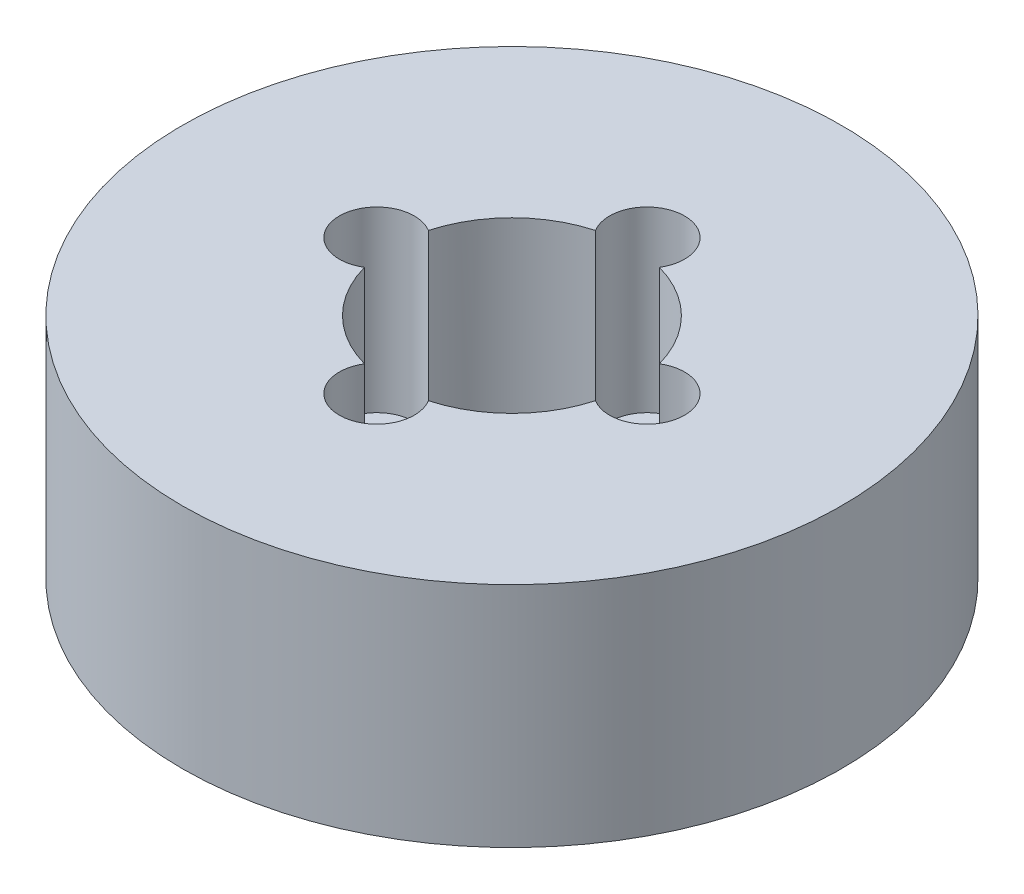
from build123d import *

# Parameters (mm, degrees)
SKETCH1_R           = 27.5
BOSS_EXTRUDE1_DEPTH = 19
SKETCH2_R           = 10
CUT_EXTRUDE1_DEPTH  = 44.283946216
SKETCH3_R           = 3.129604359
CUT_EXTRUDE2_DEPTH  = 14.865977008
CIRPATTERN1_COUNT   = 4


with BuildPart() as part:
    # Sketch1 → Boss-Extrude1 (new body)
    with BuildSketch(Plane(origin=(0, 0, 0), x_dir=(1, 0, 0), z_dir=(0, 1, 0))):
        Circle(SKETCH1_R)
    extrude(amount=BOSS_EXTRUDE1_DEPTH)

    # Sketch2 → Cut-Extrude1 (cut, through all)
    with BuildSketch(Plane(origin=(0, 0, 0), x_dir=(1, 0, 0), z_dir=(0, 1, 0))):
        Circle(SKETCH2_R)
    extrude(amount=CUT_EXTRUDE1_DEPTH, mode=Mode.SUBTRACT)

    # Sketch3 → Cut-Extrude2 (cut)
    with BuildSketch(Plane(origin=(0, 19, 0), x_dir=(1, 0, 0), z_dir=(0, 1, 0))):
        with Locations((-11.274259426, 0)):
            Circle(SKETCH3_R)
    cut_extrude2 = extrude(amount=-CUT_EXTRUDE2_DEPTH, mode=Mode.SUBTRACT)

    # CirPattern1: Cut-Extrude2 ×4 about axis
    cirpattern1_axis = Axis((0, 0, 0), (0, 1, 0))
    for i in range(1, CIRPATTERN1_COUNT):
        add(cut_extrude2.rotate(cirpattern1_axis, i * 360 / CIRPATTERN1_COUNT), mode=Mode.SUBTRACT)


solid = part.part
